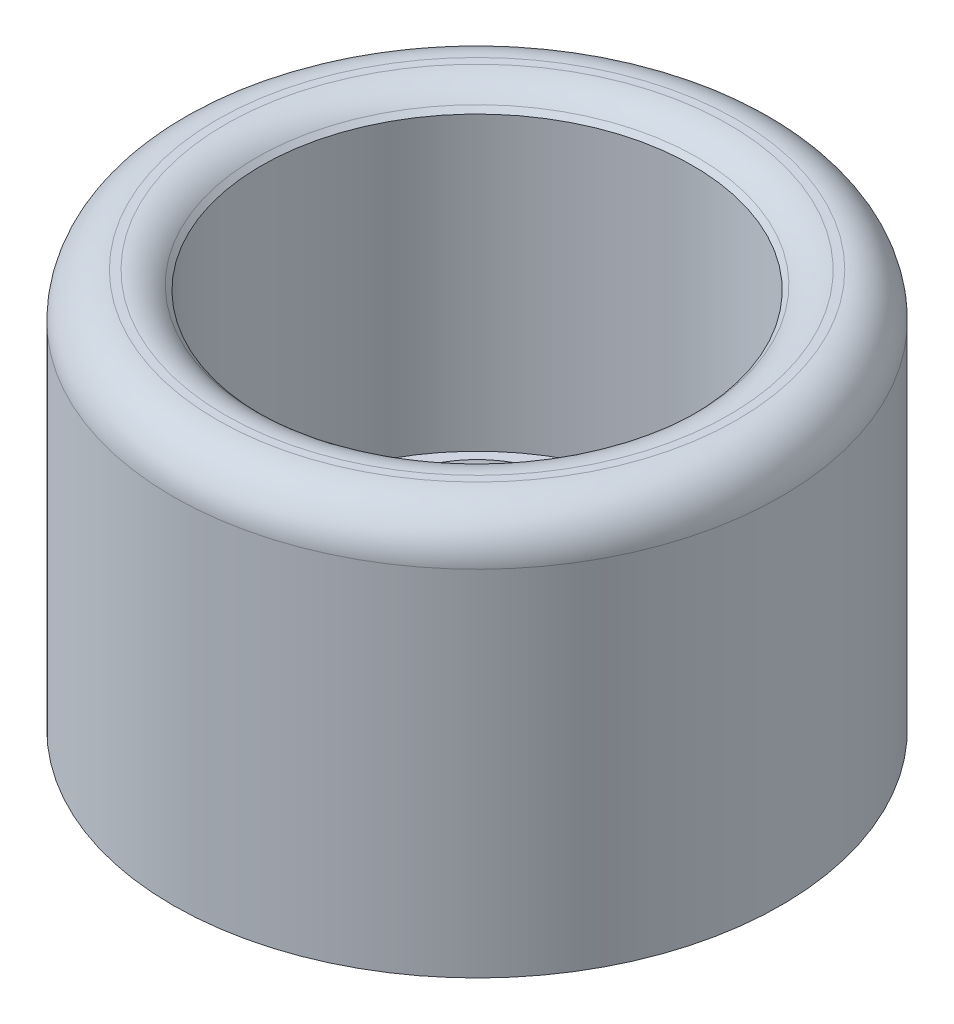
from build123d import *

# Parameters (mm, degrees)
SKETCH1_R                  = 34.384
SKETCH1_R_2                = 24.384
BOSS_EXTRUDE1_DEPTH        = 35
BOSS_EXTRUDE2_START        = -10
SKETCH1_3_R                = 34.384
BOSS_EXTRUDE2_DEPTH        = 10
SKETCH3_R                  = 12.5
BOSS_EXTRUDE3_DEPTH        = 10
FILLET1_R                  = 5
F_12_0MM_DOWEL_HOLE1_D     = 11
F_12_0MM_DOWEL_HOLE1_DEPTH = 10
F_8_0MM_DOWEL_HOLE2_D      = 9
CHAMFER1_SIZE              = 2
CHAMFER2_SIZE              = 0.5
CHAMFER4_SIZE              = 0.5
FILLET2_R                  = 5


with BuildPart() as part:
    # Sketch1 → Boss-Extrude1 (new body)
    with BuildSketch(Plane(origin=(0, 0, 0), x_dir=(1, 0, 0), z_dir=(0, 1, 0))):
        with Locations(Location((0, 0, 0), (0, 0, 270))):
            Circle(SKETCH1_R)
        with Locations(Location((0, 0, 0), (0, 0, 270))):
            Circle(SKETCH1_R_2, mode=Mode.SUBTRACT)
    extrude(amount=BOSS_EXTRUDE1_DEPTH)

    # Sketch1<3> → Boss-Extrude2 (add)
    with BuildSketch(Plane(origin=(0, 0, 0), x_dir=(1, 0, 0), z_dir=(0, 1, 0)).offset(BOSS_EXTRUDE2_START)):
        with Locations(Location((0, 0, 0), (0, 0, 270))):
            Circle(SKETCH1_3_R)
    extrude(amount=BOSS_EXTRUDE2_DEPTH)

    # Sketch3 → Boss-Extrude3 (add)
    with BuildSketch(Plane(origin=(0, 0, 0), x_dir=(1, 0, 0), z_dir=(0, 1, 0))):
        with Locations(Location((0, 0, 0), (0, 0, 270))):
            Circle(SKETCH3_R)
    extrude(amount=BOSS_EXTRUDE3_DEPTH)

    # Fillet1
    fillet1_edges = [part.edges().sort_by_distance(p)[0] for p in [
        (0, 0, -12.5),
        (0, 10, -12.5),
    ]]
    fillet(fillet1_edges, radius=FILLET1_R - 0.0001)  # a hair under: the kernel refuses the full size

    # Ø12.0mm Dowel Hole1
    with Locations(Plane(origin=(0, -10, 0), x_dir=(-1, 0, 0), z_dir=(0, -1, 0))):
        with Locations((0, 0)):
            Hole(F_12_0MM_DOWEL_HOLE1_D / 2, depth=F_12_0MM_DOWEL_HOLE1_DEPTH)

    # Ø8.0mm Dowel Hole2 (through all)
    with Locations(Plane(origin=(0, 0, 0), x_dir=(-1, 0, 0), z_dir=(0, -1, 0))):
        with Locations((0, 0)):
            Hole(F_8_0MM_DOWEL_HOLE2_D / 2)

    # Chamfer1
    chamfer1_edges = [part.edges().sort_by_distance(p)[0] for p in [
        (0, 35, -24.384),
    ]]
    chamfer(chamfer1_edges, length=CHAMFER1_SIZE)

    # Chamfer2
    chamfer2_edges = [part.edges().sort_by_distance(p)[0] for p in [
        (-5.5, -10, 0),
    ]]
    chamfer(chamfer2_edges, length=CHAMFER2_SIZE)

    # Chamfer4
    chamfer4_edges = [part.edges().sort_by_distance(p)[0] for p in [
        (-5.5, 0, 0),
        (-4.5, 0, 0),
    ]]
    chamfer(chamfer4_edges, length=CHAMFER4_SIZE - 0.0001)  # a hair under: the kernel refuses the full size

    # Fillet2
    fillet2_edges = [part.edges().sort_by_distance(p)[0] for p in [
        (0, 35, -26.384),
        (0, 35, -34.384),
    ]]
    fillet(fillet2_edges, radius=FILLET2_R)


solid = part.part
